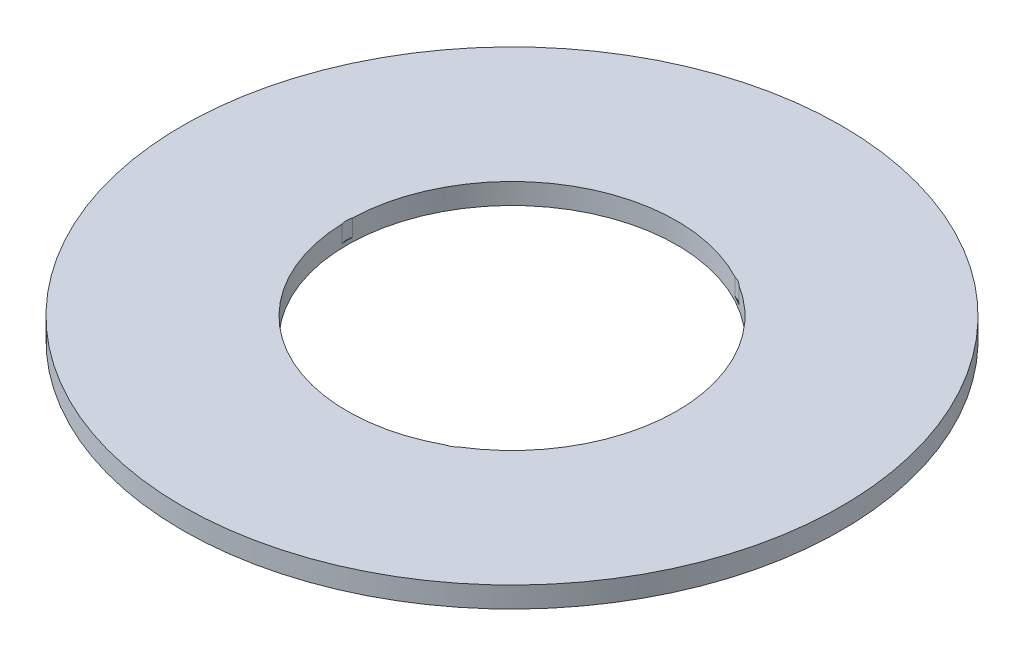
from build123d import *

# Parameters (mm, degrees)
SKETCH1_R           = 95
BOSS_EXTRUDE1_DEPTH = 6
SKETCH2_R           = 47.5
CUT_EXTRUDE1_DEPTH  = 135.484199815
SKETCH3_R           = 5.546409106
CUT_EXTRUDE2_DEPTH  = 4.861333749
CIRPATTERN1_COUNT   = 3


with BuildPart() as part:
    # Sketch1 → Boss-Extrude1 (new body)
    with BuildSketch(Plane(origin=(0, 0, 0), x_dir=(1, 0, 0), z_dir=(0, 1, 0))):
        Circle(SKETCH1_R)
    extrude(amount=BOSS_EXTRUDE1_DEPTH)

    # Sketch2 → Cut-Extrude1 (cut, through all)
    with BuildSketch(Plane(origin=(0, 0, 0), x_dir=(1, 0, 0), z_dir=(0, 1, 0))):
        Circle(SKETCH2_R)
    extrude(amount=CUT_EXTRUDE1_DEPTH, mode=Mode.SUBTRACT)

    # Sketch3 → Cut-Extrude2 (cut)
    with BuildSketch(Plane(origin=(0, 6, 0), x_dir=(1, 0, 0), z_dir=(0, 1, 0))):
        with Locations((-42.139652955, 0)):
            Circle(SKETCH3_R)
    cut_extrude2 = extrude(amount=-CUT_EXTRUDE2_DEPTH, mode=Mode.SUBTRACT)

    # CirPattern1: Cut-Extrude2 ×3 about axis
    cirpattern1_axis = Axis((0, 0, 0), (0, 1, 0))
    for i in range(1, CIRPATTERN1_COUNT):
        add(cut_extrude2.rotate(cirpattern1_axis, i * 360 / CIRPATTERN1_COUNT), mode=Mode.SUBTRACT)


solid = part.part
